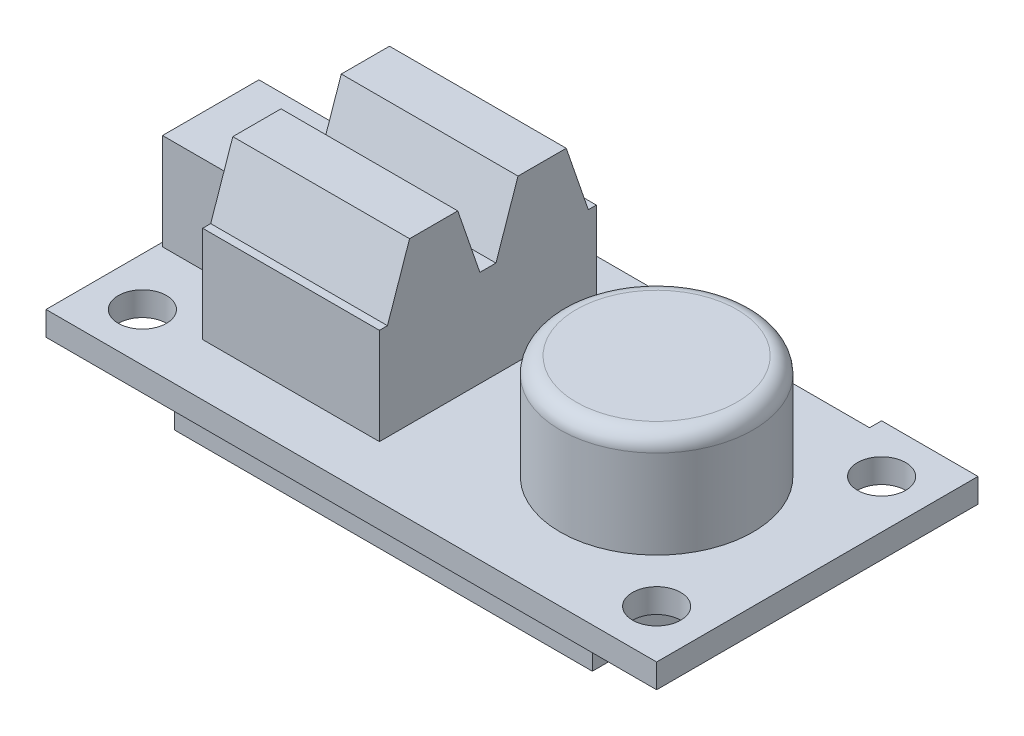
from build123d import *

# Parameters (mm, degrees)
SKETCH1_R           = 1.5
BOSS_EXTRUDE1_DEPTH = 1.5
SKETCH2_R           = 6
BOSS_EXTRUDE2_DEPTH = 6.5
FILLET1_R           = 1
SKETCH3_W           = 5
SKETCH3_H           = 6
BOSS_EXTRUDE3_DEPTH = 6
BOSS_EXTRUDE4_START = -12.5
BOSS_EXTRUDE4_DEPTH = 11
SKETCH6_W           = 26
SKETCH6_H           = 16
BOSS_EXTRUDE5_DEPTH = 3


with BuildPart() as part:
    # Sketch1 → Boss-Extrude1 (new body)
    with BuildSketch(Plane(origin=(0, 0, 0), x_dir=(1, 0, 0), z_dir=(0, 1, 0))):
        Polygon((-19, -10), (19, -10), (19, 10), (13, 10), (13, 9.25), (1, 9.25), (1, 10), (-19, 10), align=None)
        with Locations((-16, 7)):
            Circle(SKETCH1_R, mode=Mode.SUBTRACT)
        with Locations((-16, -7)):
            Circle(SKETCH1_R, mode=Mode.SUBTRACT)
        with Locations((16, -7)):
            Circle(SKETCH1_R, mode=Mode.SUBTRACT)
        with Locations((16, 7)):
            Circle(SKETCH1_R, mode=Mode.SUBTRACT)
    extrude(amount=BOSS_EXTRUDE1_DEPTH)

    # Sketch2 → Boss-Extrude2 (add)
    with BuildSketch(Plane(origin=(0, 1.5, 0), x_dir=(1, 0, 0), z_dir=(0, 1, 0))):
        with Locations((9, 0)):
            Circle(SKETCH2_R)
    extrude(amount=BOSS_EXTRUDE2_DEPTH)

    # Fillet1
    fillet1_edges = [part.edges().sort_by_distance(p)[0] for p in [
        (3, 8, 0),
    ]]
    fillet(fillet1_edges, radius=FILLET1_R)

    # Sketch3 → Boss-Extrude3 (add)
    with BuildSketch(Plane(origin=(0, 1.5, 0), x_dir=(1, 0, 0), z_dir=(0, 1, 0))):
        with Locations((-16.25, 0)):
            Rectangle(SKETCH3_W, SKETCH3_H)
    extrude(amount=BOSS_EXTRUDE3_DEPTH)

    # Sketch5 → Boss-Extrude4 (add)
    with BuildSketch(Plane(origin=(0, 0, 0), x_dir=(0, 0, -1), z_dir=(1, 0, 0)).offset(BOSS_EXTRUDE4_START)):
        Polygon((6.75, 1.5), (6.75, 7.5), (6.25, 7.5), (4.875, 11.5), (1.875, 11.5), (0.5, 7.5), (-0.5, 7.5), (-1.875, 11.5), (-4.875, 11.5), (-6.25, 7.5), (-6.75, 7.5), (-6.75, 1.5), align=None)
    extrude(amount=BOSS_EXTRUDE4_DEPTH)

    # Sketch6 → Boss-Extrude5 (add)
    with BuildSketch(Plane.XZ):
        Rectangle(SKETCH6_W, SKETCH6_H)
    extrude(amount=BOSS_EXTRUDE5_DEPTH)


solid = part.part
